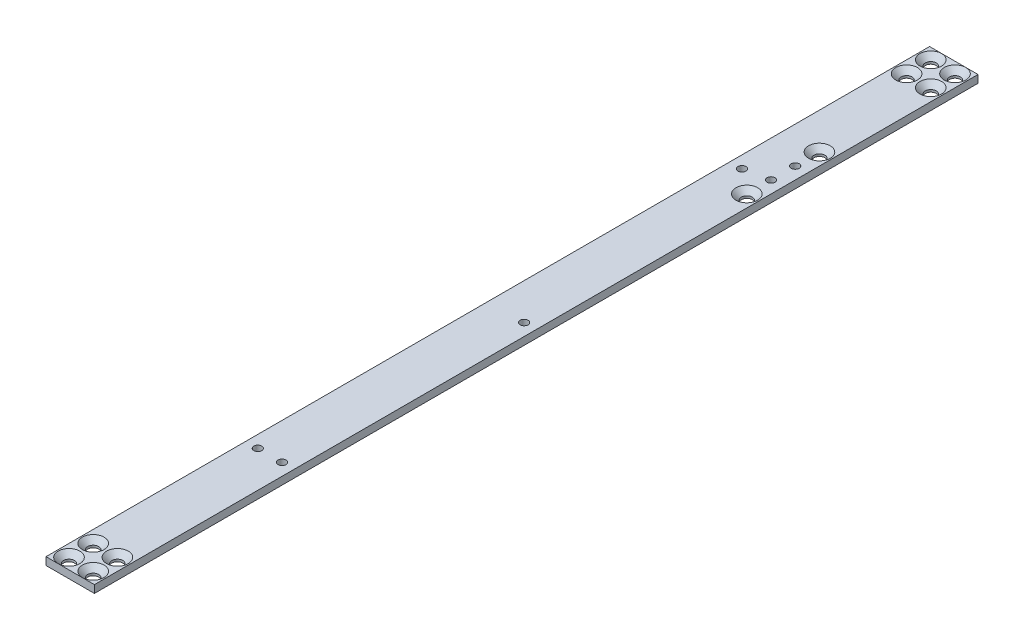
from build123d import *

# Parameters (mm, degrees)
SKETCH1_W                     = 20
SKETCH1_H                     = 365
BOSS_EXTRUDE1_DEPTH           = 3.175
CSK_FOR_M4_SFHCS1_AT_2_COUNT  = 2
CSK_FOR_M4_SFHCS1_AT_2_PITCH  = 14.142135624
CSK_FOR_M4_SFHCS1_AT_3_COUNT  = 2
CSK_FOR_M4_SFHCS1_AT_3_PITCH  = 10
CSK_FOR_M4_SFHCS1_AT_4_COUNT  = 2
CSK_FOR_M4_SFHCS1_AT_4_PITCH  = 10
CSK_FOR_M4_SFHCS1_AT_5_COUNT  = 2
CSK_FOR_M4_SFHCS1_AT_5_PITCH  = 346
CSK_FOR_M4_SFHCS1_AT_6_COUNT  = 2
CSK_FOR_M4_SFHCS1_AT_6_PITCH  = 336.148776586
CSK_FOR_M4_SFHCS1_AT_7_COUNT  = 2
CSK_FOR_M4_SFHCS1_AT_7_PITCH  = 346.144478506
CSK_FOR_M4_SFHCS1_AT_8_COUNT  = 2
CSK_FOR_M4_SFHCS1_AT_8_PITCH  = 336
CSK_FOR_M4_SFHCS1_AT_9_COUNT  = 2
CSK_FOR_M4_SFHCS1_AT_9_PITCH  = 260
CSK_FOR_M4_SFHCS1_AT_10_COUNT = 2
CSK_FOR_M4_SFHCS1_AT_10_PITCH = 290
M4X0_7_TAPPED_HOLE1_D         = 3.3


with BuildPart() as part:
    # Sketch1 → Boss-Extrude1 (new body)
    with BuildSketch(Plane(origin=(0, 0, 0), x_dir=(1, 0, 0), z_dir=(0, 1, 0))):
        Rectangle(SKETCH1_W, SKETCH1_H)
    extrude(amount=BOSS_EXTRUDE1_DEPTH)

    # Sketch3 → CSK for M4 SFHCS1 (revolve, cut)
    with BuildSketch(Plane(origin=(5, 3.175, 168), x_dir=(0, 0, 1), z_dir=(1, 0, 0))):
        Polygon((0, 0), (0, 3.175), (2.25, 3.175), (2.25, 2.23), (4.48, 0), align=None)
    csk_for_m4_sfhcs1 = revolve(axis=Axis((5, 9.525, 168), (0, -1, 0)), mode=Mode.SUBTRACT)

    # CSK for M4 SFHCS1 at 2: CSK for M4 SFHCS1 ×2
    with Locations(*[Vector(-0.7071067811865469, 0, 0.7071067811865482) * (i * CSK_FOR_M4_SFHCS1_AT_2_PITCH) for i in range(1, CSK_FOR_M4_SFHCS1_AT_2_COUNT)]):
        add(csk_for_m4_sfhcs1, mode=Mode.SUBTRACT)

    # CSK for M4 SFHCS1 at 3: CSK for M4 SFHCS1 ×2
    with Locations(*[(-i * CSK_FOR_M4_SFHCS1_AT_3_PITCH, 0, 0) for i in range(1, CSK_FOR_M4_SFHCS1_AT_3_COUNT)]):
        add(csk_for_m4_sfhcs1, mode=Mode.SUBTRACT)

    # CSK for M4 SFHCS1 at 4: CSK for M4 SFHCS1 ×2
    with Locations(*[(0, 0, i * CSK_FOR_M4_SFHCS1_AT_4_PITCH) for i in range(1, CSK_FOR_M4_SFHCS1_AT_4_COUNT)]):
        add(csk_for_m4_sfhcs1, mode=Mode.SUBTRACT)

    # CSK for M4 SFHCS1 at 5: CSK for M4 SFHCS1 ×2
    with Locations(*[(0, 0, -i * CSK_FOR_M4_SFHCS1_AT_5_PITCH) for i in range(1, CSK_FOR_M4_SFHCS1_AT_5_COUNT)]):
        add(csk_for_m4_sfhcs1, mode=Mode.SUBTRACT)

    # CSK for M4 SFHCS1 at 6: CSK for M4 SFHCS1 ×2
    with Locations(*[Vector(-0.029748732396333223, 0, -0.9995574085167952) * (i * CSK_FOR_M4_SFHCS1_AT_6_PITCH) for i in range(1, CSK_FOR_M4_SFHCS1_AT_6_COUNT)]):
        add(csk_for_m4_sfhcs1, mode=Mode.SUBTRACT)

    # CSK for M4 SFHCS1 at 7: CSK for M4 SFHCS1 ×2
    with Locations(*[Vector(-0.028889670703889703, 0, -0.9995826063545828) * (i * CSK_FOR_M4_SFHCS1_AT_7_PITCH) for i in range(1, CSK_FOR_M4_SFHCS1_AT_7_COUNT)]):
        add(csk_for_m4_sfhcs1, mode=Mode.SUBTRACT)

    # CSK for M4 SFHCS1 at 8: CSK for M4 SFHCS1 ×2
    with Locations(*[(0, 0, -i * CSK_FOR_M4_SFHCS1_AT_8_PITCH) for i in range(1, CSK_FOR_M4_SFHCS1_AT_8_COUNT)]):
        add(csk_for_m4_sfhcs1, mode=Mode.SUBTRACT)

    # CSK for M4 SFHCS1 at 9: CSK for M4 SFHCS1 ×2
    with Locations(*[(0, 0, -i * CSK_FOR_M4_SFHCS1_AT_9_PITCH) for i in range(1, CSK_FOR_M4_SFHCS1_AT_9_COUNT)]):
        add(csk_for_m4_sfhcs1, mode=Mode.SUBTRACT)

    # CSK for M4 SFHCS1 at 10: CSK for M4 SFHCS1 ×2
    with Locations(*[(0, 0, -i * CSK_FOR_M4_SFHCS1_AT_10_PITCH) for i in range(1, CSK_FOR_M4_SFHCS1_AT_10_COUNT)]):
        add(csk_for_m4_sfhcs1, mode=Mode.SUBTRACT)

    # M4x0.7 Tapped Hole1 (through all)
    with Locations(Plane(origin=(0, 3.175, 0), x_dir=(1, 0, 0), z_dir=(0, 1, 0))):
        with Locations((-5, -100), (-5, 100), (5, -100), (5, 0), (5, 102), (5, 112)):
            Hole(M4X0_7_TAPPED_HOLE1_D / 2)


solid = part.part
